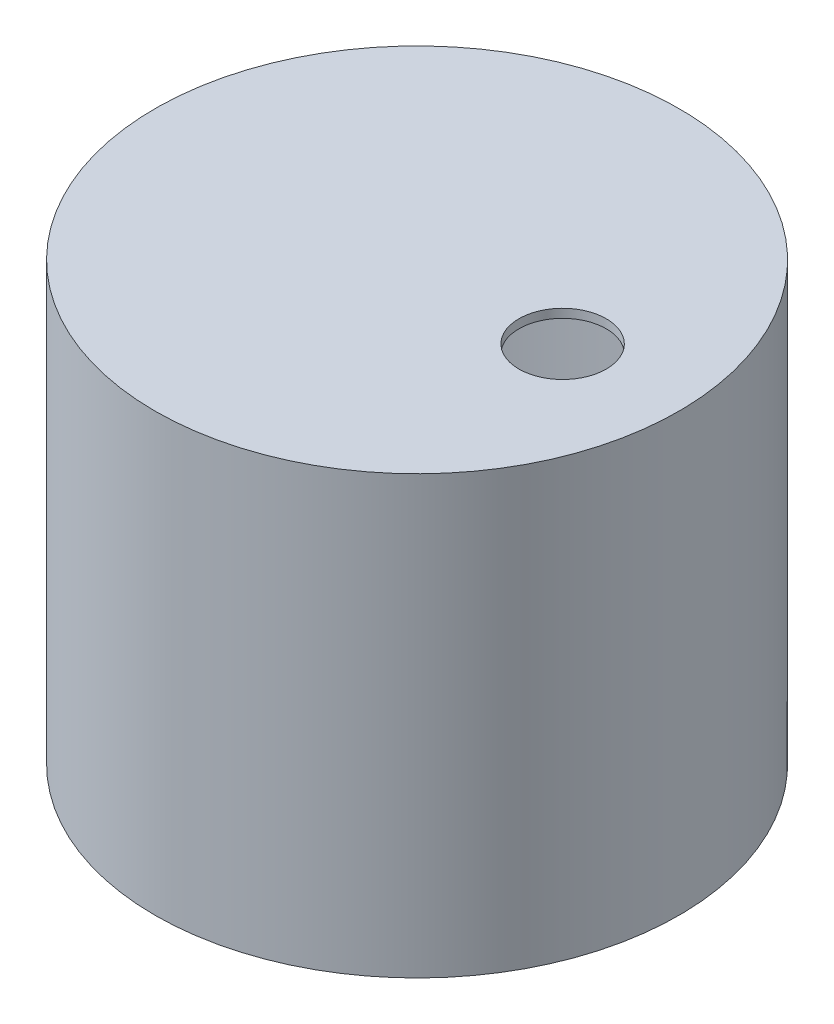
from build123d import *

# Parameters (mm, degrees)
RESERVOIR_WALL_SKETCH_R    = 180
RESERVOIR_WALL_SKETCH_R_2  = 176
RESERVOIR_WALL_SKIRT_DEPTH = 300
RESERVOIR_START            = 40
RESERVOIR_FLOOR_SKETCH_R   = 180
RESERVOIR_FLOOR_SKETCH_R_2 = 10
RESERVOIR_FLOOR_DEPTH      = 6
SEALED_START               = 294
SEALED_LID_SKETCH_R        = 180
SEALED_LID_SKETCH_R_2      = 30
SEALED_LID_DEPTH           = 6


with BuildPart() as part:
    # Reservoir Wall Sketch → Reservoir Wall + Skirt (new body)
    with BuildSketch(Plane(origin=(0, 0, 0), x_dir=(1, 0, 0), z_dir=(0, 1, 0))):
        Circle(RESERVOIR_WALL_SKETCH_R)
        Circle(RESERVOIR_WALL_SKETCH_R_2, mode=Mode.SUBTRACT)
    extrude(amount=RESERVOIR_WALL_SKIRT_DEPTH)

    # Reservoir Floor Sketch → Reservoir Floor (add)
    with BuildSketch(Plane(origin=(0, 0, 0), x_dir=(1, 0, 0), z_dir=(0, 1, 0)).offset(RESERVOIR_START)):
        Circle(RESERVOIR_FLOOR_SKETCH_R)
        Circle(RESERVOIR_FLOOR_SKETCH_R_2, mode=Mode.SUBTRACT)
    extrude(amount=RESERVOIR_FLOOR_DEPTH)

    # Sealed Lid Sketch → Sealed Lid (add)
    with BuildSketch(Plane(origin=(0, 0, 0), x_dir=(1, 0, 0), z_dir=(0, 1, 0)).offset(SEALED_START)):
        Circle(SEALED_LID_SKETCH_R)
        with Locations((100, 0)):
            Circle(SEALED_LID_SKETCH_R_2, mode=Mode.SUBTRACT)
    extrude(amount=SEALED_LID_DEPTH)


solid = part.part
